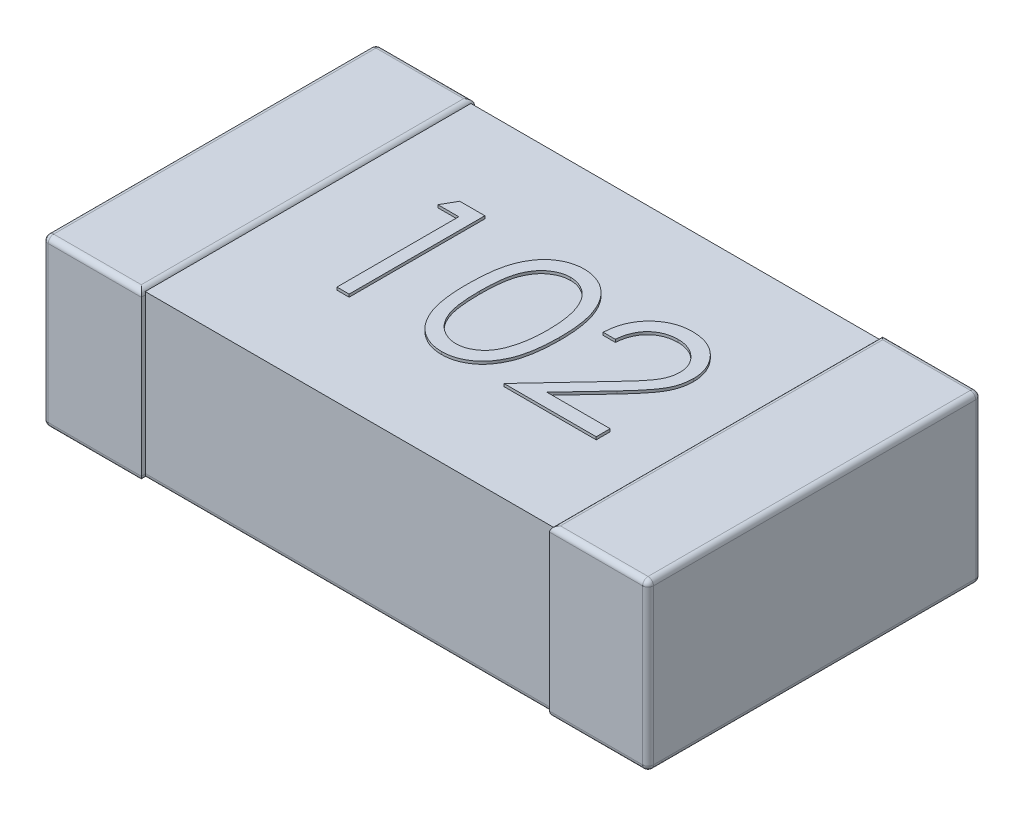
from build123d import *

# Parameters (mm, degrees)
SKETCH1_W           = 2.2
SKETCH1_H           = 1.2
BOSS_EXTRUDE1_DEPTH = 0.6
SKETCH2_W           = 0.362885264
SKETCH2_H           = 1.227310462
BOSS_EXTRUDE2_DEPTH = 0.611
FILLET1_R           = 0.02
WRITING_DEPTH       = 0.01
WRITING_2_DEPTH     = 0.01
WRITING_3_DEPTH     = 0.01


with BuildPart() as part:
    # Sketch1 → Boss-Extrude1 (new body)
    with BuildSketch(Plane(origin=(0, 0, 0), x_dir=(1, 0, 0), z_dir=(0, 1, 0))):
        Rectangle(SKETCH1_W, SKETCH1_H)
    extrude(amount=BOSS_EXTRUDE1_DEPTH)

    # Sketch2 → Boss-Extrude2 (add)
    with BuildSketch(Plane(origin=(0, 0, 0), x_dir=(1, 0, 0), z_dir=(0, 1, 0))):
        with Locations((-0.932127672, -0.002708099)):
            Rectangle(SKETCH2_W, SKETCH2_H)
        with Locations((0.932127672, 0)):
            Rectangle(SKETCH2_W, SKETCH2_H)
    extrude(amount=BOSS_EXTRUDE2_DEPTH)

    # Fillet1
    # the kernel refuses this fillet: 0.02 mm, written as the material it takes off along each edge
    with BuildSketch(Plane(origin=(-1.093570304, 0.02, -0.590947132), x_dir=(0, 0, -1), z_dir=(0, -1, 0))) as fillet1_piece_1_section:
        Polygon((0, 0), (FILLET1_R, 0), (FILLET1_R, -FILLET1_R), (0, -FILLET1_R), align=None)
    fillet1_piece_1 = extrude(amount=FILLET1_R, mode=Mode.PRIVATE)
    fillet1_piece_1 = fillet1_piece_1 - Plane(origin=(-1.093570304, 0.02, -0.590947132), x_dir=(0.7071067811865475, 0, 0.7071067811865475), z_dir=(0, -1, 0)) * Sphere(FILLET1_R, mode=Mode.PRIVATE)
    add(fillet1_piece_1, mode=Mode.SUBTRACT)
    with BuildSketch(Plane(origin=(-1.093570304, 0.02, 0.59636333), x_dir=(0, 0, 1), z_dir=(0, -1, 0))) as fillet1_piece_2_section:
        Polygon((0, 0), (FILLET1_R, 0), (FILLET1_R, FILLET1_R), (0, FILLET1_R), align=None)
    fillet1_piece_2 = extrude(amount=FILLET1_R, mode=Mode.PRIVATE)
    fillet1_piece_2 = fillet1_piece_2 - Plane(origin=(-1.093570304, 0.02, 0.59636333), x_dir=(0.7071067811865474, 0, -0.7071067811865478), z_dir=(0, -1, 0)) * Sphere(FILLET1_R, mode=Mode.PRIVATE)
    add(fillet1_piece_2, mode=Mode.SUBTRACT)
    with BuildSketch(Plane(origin=(1.093570304, 0.02, 0.593655231), x_dir=(1, 0, 0), z_dir=(0, -1, 0))) as fillet1_piece_3_section:
        Polygon((0, 0), (FILLET1_R, 0), (FILLET1_R, FILLET1_R), (0, FILLET1_R), align=None)
    fillet1_piece_3 = extrude(amount=FILLET1_R, mode=Mode.PRIVATE)
    fillet1_piece_3 = fillet1_piece_3 - Plane(origin=(1.093570304, 0.02, 0.593655231), x_dir=(-0.707106781186548, 0, -0.707106781186547), z_dir=(0, -1, 0)) * Sphere(FILLET1_R, mode=Mode.PRIVATE)
    add(fillet1_piece_3, mode=Mode.SUBTRACT)
    with BuildSketch(Plane(origin=(1.093570304, 0.02, -0.593655231), x_dir=(1, 0, 0), z_dir=(0, -1, 0))) as fillet1_piece_4_section:
        Polygon((0, 0), (FILLET1_R, 0), (FILLET1_R, -FILLET1_R), (0, -FILLET1_R), align=None)
    fillet1_piece_4 = extrude(amount=FILLET1_R, mode=Mode.PRIVATE)
    fillet1_piece_4 = fillet1_piece_4 - Plane(origin=(1.093570304, 0.02, -0.593655231), x_dir=(-0.7071067811865474, 0, 0.7071067811865478), z_dir=(0, -1, 0)) * Sphere(FILLET1_R, mode=Mode.PRIVATE)
    add(fillet1_piece_4, mode=Mode.SUBTRACT)
    with BuildSketch(Plane(origin=(-1.093570304, 0.591, -0.590947132), x_dir=(0, 0, -1), z_dir=(0, 1, 0))) as fillet1_piece_5_section:
        Polygon((0, 0), (FILLET1_R, 0), (FILLET1_R, FILLET1_R), (0, FILLET1_R), align=None)
    fillet1_piece_5 = extrude(amount=FILLET1_R, mode=Mode.PRIVATE)
    fillet1_piece_5 = fillet1_piece_5 - Plane(origin=(-1.093570304, 0.591, -0.590947132), x_dir=(0.7071067811865475, 0, 0.7071067811865475), z_dir=(0, 1, 0)) * Sphere(FILLET1_R, mode=Mode.PRIVATE)
    add(fillet1_piece_5, mode=Mode.SUBTRACT)
    with BuildSketch(Plane(origin=(-1.093570304, 0.591, 0.59636333), x_dir=(0, 1, 0), z_dir=(0, 0, 1))) as fillet1_piece_6_section:
        Polygon((0, 0), (FILLET1_R, 0), (FILLET1_R, FILLET1_R), (0, FILLET1_R), align=None)
    fillet1_piece_6 = extrude(amount=FILLET1_R, mode=Mode.PRIVATE)
    fillet1_piece_6 = fillet1_piece_6 - Plane(origin=(-1.093570304, 0.591, 0.59636333), x_dir=(0.7071067811865475, -0.7071067811865475, 0), z_dir=(0, 0, 1)) * Sphere(FILLET1_R, mode=Mode.PRIVATE)
    add(fillet1_piece_6, mode=Mode.SUBTRACT)
    with BuildSketch(Plane(origin=(1.093570304, 0.591, 0.593655231), x_dir=(0, 0, 1), z_dir=(1, 0, 0))) as fillet1_piece_7_section:
        Polygon((0, 0), (FILLET1_R, 0), (FILLET1_R, -FILLET1_R), (0, -FILLET1_R), align=None)
    fillet1_piece_7 = extrude(amount=FILLET1_R, mode=Mode.PRIVATE)
    fillet1_piece_7 = fillet1_piece_7 - Plane(origin=(1.093570304, 0.591, 0.593655231), x_dir=(0, -0.7071067811865475, -0.7071067811865475), z_dir=(1, 0, 0)) * Sphere(FILLET1_R, mode=Mode.PRIVATE)
    add(fillet1_piece_7, mode=Mode.SUBTRACT)
    with BuildSketch(Plane(origin=(1.093570304, 0.591, -0.593655231), x_dir=(0, 0, -1), z_dir=(1, 0, 0))) as fillet1_piece_8_section:
        Polygon((0, 0), (FILLET1_R, 0), (FILLET1_R, FILLET1_R), (0, FILLET1_R), align=None)
    fillet1_piece_8 = extrude(amount=FILLET1_R, mode=Mode.PRIVATE)
    fillet1_piece_8 = fillet1_piece_8 - Plane(origin=(1.093570304, 0.591, -0.593655231), x_dir=(0, -0.7071067811865475, 0.7071067811865475), z_dir=(1, 0, 0)) * Sphere(FILLET1_R, mode=Mode.PRIVATE)
    add(fillet1_piece_8, mode=Mode.SUBTRACT)
    with BuildSketch(Plane(origin=(-0.75068504, 0, -0.660947132), x_dir=(-1, 0, 0), z_dir=(0, 0, 1))) as fillet1_piece_9:
        with BuildLine():
            CenterArc((FILLET1_R, -FILLET1_R), FILLET1_R, 90, 90)
            Line((0, -FILLET1_R), (0, 0))
            Line((0, 0), (FILLET1_R, 0))
        make_face()
    extrude(amount=0.060947132, mode=Mode.SUBTRACT)
    with BuildSketch(Plane(origin=(-1.093570304, 0, -0.610947132), x_dir=(0, 0, 1), z_dir=(1, 0, 0)), Plane(origin=(-0.70068504, 0, 0.61636333), x_dir=(0, 0, -1), z_dir=(-1, 0, 0)), Plane(origin=(-0.70068504, 0.611, 0.61636333), x_dir=(0, -1, 0), z_dir=(-1, 0, 0))) as fillet1_piece_10:
        with BuildLine():
            CenterArc((FILLET1_R, -FILLET1_R), FILLET1_R, 90, 90)
            Line((0, -FILLET1_R), (0, 0))
            Line((0, 0), (FILLET1_R, 0))
        make_face()
    extrude(amount=0.392885264, mode=Mode.SUBTRACT)
    with BuildSketch(Plane(origin=(-0.75068504, 0, 0.6), x_dir=(-1, 0, 0), z_dir=(0, 0, 1))) as fillet1_piece_11:
        with BuildLine():
            CenterArc((FILLET1_R, -FILLET1_R), FILLET1_R, 90, 90)
            Line((0, -FILLET1_R), (0, 0))
            Line((0, 0), (FILLET1_R, 0))
        make_face()
    extrude(amount=0.06636333, mode=Mode.SUBTRACT)
    with BuildSketch(Plane(origin=(-0.75068504, 0, 0.6), x_dir=(0, 0, -1), z_dir=(1, 0, 0)), Plane(origin=(0.75068504, 0, -0.6), x_dir=(0, 0, 1), z_dir=(-1, 0, 0))) as fillet1_piece_12:
        with BuildLine():
            CenterArc((FILLET1_R, FILLET1_R), FILLET1_R, 180, 90)
            Line((0, FILLET1_R), (0, 0))
            Line((0, 0), (FILLET1_R, 0))
        make_face()
    extrude(amount=1.501370079, mode=Mode.SUBTRACT)
    with BuildSketch(Plane(origin=(0.75068504, 0, 0.6), x_dir=(1, 0, 0), z_dir=(0, 0, 1)), Plane(origin=(0.75068504, 0, -0.663655231), x_dir=(1, 0, 0), z_dir=(0, 0, 1))) as fillet1_piece_13:
        with BuildLine():
            CenterArc((FILLET1_R, FILLET1_R), FILLET1_R, 180, 90)
            Line((0, FILLET1_R), (0, 0))
            Line((0, 0), (FILLET1_R, 0))
        make_face()
    extrude(amount=0.063655231, mode=Mode.SUBTRACT)
    with BuildSketch(Plane(origin=(0.70068504, 0, 0.613655231), x_dir=(0, 0, -1), z_dir=(1, 0, 0)), Plane(origin=(1.093570304, 0, -0.613655231), x_dir=(0, 0, 1), z_dir=(-1, 0, 0)), Plane(origin=(-1.093570304, 0.611, -0.610947132), x_dir=(0, 0, 1), z_dir=(1, 0, 0)), Plane(origin=(0.70068504, 0.611, 0.613655231), x_dir=(0, -1, 0), z_dir=(1, 0, 0)), Plane(origin=(1.093570304, 0.611, -0.613655231), x_dir=(0, -1, 0), z_dir=(-1, 0, 0))) as fillet1_piece_14:
        with BuildLine():
            CenterArc((FILLET1_R, FILLET1_R), FILLET1_R, 180, 90)
            Line((0, FILLET1_R), (0, 0))
            Line((0, 0), (FILLET1_R, 0))
        make_face()
    extrude(amount=0.392885264, mode=Mode.SUBTRACT)
    with BuildSketch(Plane(origin=(-1.113570304, 0, 0.59636333), x_dir=(1, 0, 0), z_dir=(0, 0, -1))) as fillet1_piece_15:
        with BuildLine():
            CenterArc((FILLET1_R, -FILLET1_R), FILLET1_R, 90, 90)
            Line((0, -FILLET1_R), (0, 0))
            Line((0, 0), (FILLET1_R, 0))
        make_face()
    extrude(amount=1.187310461, mode=Mode.SUBTRACT)
    with BuildSketch(Plane(origin=(-1.113570304, 0.02, -0.610947132), x_dir=(1, 0, 0), z_dir=(0, 1, 0)), Plane(origin=(1.113570304, 0.02, -0.613655231), x_dir=(0, 0, 1), z_dir=(0, 1, 0))) as fillet1_piece_16:
        with BuildLine():
            CenterArc((FILLET1_R, -FILLET1_R), FILLET1_R, 90, 90)
            Line((0, -FILLET1_R), (0, 0))
            Line((0, 0), (FILLET1_R, 0))
        make_face()
    extrude(amount=0.571, mode=Mode.SUBTRACT)
    with BuildSketch(Plane(origin=(-1.113570304, 0.02, 0.61636333), x_dir=(1, 0, 0), z_dir=(0, 1, 0)), Plane(origin=(1.113570304, 0.02, 0.613655231), x_dir=(0, 0, -1), z_dir=(0, 1, 0))) as fillet1_piece_17:
        with BuildLine():
            CenterArc((FILLET1_R, FILLET1_R), FILLET1_R, 180, 90)
            Line((0, FILLET1_R), (0, 0))
            Line((0, 0), (FILLET1_R, 0))
        make_face()
    extrude(amount=0.571, mode=Mode.SUBTRACT)
    with BuildSketch(Plane(origin=(-1.113570304, 0.611, 0.59636333), x_dir=(1, 0, 0), z_dir=(0, 0, -1)), Plane(origin=(1.113570304, 0, 0.593655231), x_dir=(-1, 0, 0), z_dir=(0, 0, -1)), Plane(origin=(1.113570304, 0.611, 0.593655231), x_dir=(0, -1, 0), z_dir=(0, 0, -1))) as fillet1_piece_18:
        with BuildLine():
            CenterArc((FILLET1_R, FILLET1_R), FILLET1_R, 180, 90)
            Line((0, FILLET1_R), (0, 0))
            Line((0, 0), (FILLET1_R, 0))
        make_face()
    extrude(amount=1.187310461, mode=Mode.SUBTRACT)
    with BuildSketch(Plane(origin=(-0.75068504, 0.611, -0.660947132), x_dir=(0, -1, 0), z_dir=(0, 0, 1))) as fillet1_piece_19_section:
        with BuildLine():
            CenterArc((FILLET1_R, -FILLET1_R), FILLET1_R, 90, 90)
            Line((0, -FILLET1_R), (0, 0))
            Line((0, 0), (FILLET1_R, 0))
        make_face()
    fillet1_piece_19 = extrude(amount=1.327310461, mode=Mode.PRIVATE)
    fillet1_piece_19 = split(fillet1_piece_19, bisect_by=Plane(origin=(-0.751015921, 0.596945436, -0.6), z_dir=(0, 0, -1)), keep=Keep.TOP, mode=Mode.PRIVATE)
    fillet1_piece_19 = split(fillet1_piece_19, bisect_by=Plane(origin=(-0.751015921, 0.6, -0.630473566), z_dir=(0, -1, 0)), keep=Keep.TOP, mode=Mode.PRIVATE)
    add(fillet1_piece_19, mode=Mode.SUBTRACT)
    with BuildSketch(Plane(origin=(-0.75068504, 0.611, -0.660947132), x_dir=(0, -1, 0), z_dir=(0, 0, 1))) as fillet1_piece_20_section:
        with BuildLine():
            CenterArc((FILLET1_R, -FILLET1_R), FILLET1_R, 90, 90)
            Line((0, -FILLET1_R), (0, 0))
            Line((0, 0), (FILLET1_R, 0))
        make_face()
    fillet1_piece_20 = extrude(amount=1.327310461, mode=Mode.PRIVATE)
    fillet1_piece_20 = split(fillet1_piece_20, bisect_by=Plane(origin=(-0.75566279, 0.607493192, -0.6), z_dir=(0, 0, -1)), keep=Keep.TOP, mode=Mode.PRIVATE)
    fillet1_piece_20 = split(fillet1_piece_20, bisect_by=Plane(origin=(-0.75566279, 0.6, -0.630473566), z_dir=(0, 1, 0)), keep=Keep.TOP, mode=Mode.PRIVATE)
    add(fillet1_piece_20, mode=Mode.SUBTRACT)
    with BuildSketch(Plane(origin=(-0.75068504, 0.611, -0.660947132), x_dir=(0, -1, 0), z_dir=(0, 0, 1))) as fillet1_piece_21_section:
        with BuildLine():
            CenterArc((FILLET1_R, -FILLET1_R), FILLET1_R, 90, 90)
            Line((0, -FILLET1_R), (0, 0))
            Line((0, 0), (FILLET1_R, 0))
        make_face()
    fillet1_piece_21 = extrude(amount=1.327310461, mode=Mode.PRIVATE)
    fillet1_piece_21 = split(fillet1_piece_21, bisect_by=Plane(origin=(-0.75566279, 0.607493192, 0.6), z_dir=(0, 0, -1)), keep=Keep.TOP, mode=Mode.PRIVATE)
    fillet1_piece_21 = split(fillet1_piece_21, bisect_by=Plane(origin=(-0.75566279, 0.607493192, -0.6), z_dir=(0, 0, 1)), keep=Keep.TOP, mode=Mode.PRIVATE)
    fillet1_piece_21 = split(fillet1_piece_21, bisect_by=Plane(origin=(-0.75566279, 0.6, 0), z_dir=(0, 1, 0)), keep=Keep.TOP, mode=Mode.PRIVATE)
    add(fillet1_piece_21, mode=Mode.SUBTRACT)
    with BuildSketch(Plane(origin=(-0.75068504, 0.611, -0.660947132), x_dir=(0, -1, 0), z_dir=(0, 0, 1))) as fillet1_piece_22_section:
        with BuildLine():
            CenterArc((FILLET1_R, -FILLET1_R), FILLET1_R, 90, 90)
            Line((0, -FILLET1_R), (0, 0))
            Line((0, 0), (FILLET1_R, 0))
        make_face()
    fillet1_piece_22 = extrude(amount=1.327310461, mode=Mode.PRIVATE)
    fillet1_piece_22 = split(fillet1_piece_22, bisect_by=Plane(origin=(-0.751015921, 0.596945436, 0.6), z_dir=(0, 0, 1)), keep=Keep.TOP, mode=Mode.PRIVATE)
    fillet1_piece_22 = split(fillet1_piece_22, bisect_by=Plane(origin=(-0.751015921, 0.6, 0.633181665), z_dir=(0, -1, 0)), keep=Keep.TOP, mode=Mode.PRIVATE)
    add(fillet1_piece_22, mode=Mode.SUBTRACT)
    with BuildSketch(Plane(origin=(-0.75068504, 0.611, -0.660947132), x_dir=(0, -1, 0), z_dir=(0, 0, 1))) as fillet1_piece_23_section:
        with BuildLine():
            CenterArc((FILLET1_R, -FILLET1_R), FILLET1_R, 90, 90)
            Line((0, -FILLET1_R), (0, 0))
            Line((0, 0), (FILLET1_R, 0))
        make_face()
    fillet1_piece_23 = extrude(amount=1.327310461, mode=Mode.PRIVATE)
    fillet1_piece_23 = split(fillet1_piece_23, bisect_by=Plane(origin=(-0.75566279, 0.607493192, 0.6), z_dir=(0, 0, 1)), keep=Keep.TOP, mode=Mode.PRIVATE)
    fillet1_piece_23 = split(fillet1_piece_23, bisect_by=Plane(origin=(-0.75566279, 0.6, 0.633181665), z_dir=(0, 1, 0)), keep=Keep.TOP, mode=Mode.PRIVATE)
    add(fillet1_piece_23, mode=Mode.SUBTRACT)
    with BuildSketch(Plane(origin=(0.75068504, 0.611, -0.663655231), x_dir=(0, -1, 0), z_dir=(0, 0, 1))) as fillet1_piece_24_section:
        with BuildLine():
            CenterArc((FILLET1_R, FILLET1_R), FILLET1_R, 180, 90)
            Line((0, FILLET1_R), (0, 0))
            Line((0, 0), (FILLET1_R, 0))
        make_face()
    fillet1_piece_24 = extrude(amount=1.327310461, mode=Mode.PRIVATE)
    fillet1_piece_24 = split(fillet1_piece_24, bisect_by=Plane(origin=(0.751015921, 0.596945436, -0.6), z_dir=(0, 0, -1)), keep=Keep.TOP, mode=Mode.PRIVATE)
    fillet1_piece_24 = split(fillet1_piece_24, bisect_by=Plane(origin=(0.751015921, 0.6, -0.631827615), z_dir=(0, -1, 0)), keep=Keep.TOP, mode=Mode.PRIVATE)
    add(fillet1_piece_24, mode=Mode.SUBTRACT)
    with BuildSketch(Plane(origin=(0.75068504, 0.611, -0.663655231), x_dir=(0, -1, 0), z_dir=(0, 0, 1))) as fillet1_piece_25_section:
        with BuildLine():
            CenterArc((FILLET1_R, FILLET1_R), FILLET1_R, 180, 90)
            Line((0, FILLET1_R), (0, 0))
            Line((0, 0), (FILLET1_R, 0))
        make_face()
    fillet1_piece_25 = extrude(amount=1.327310461, mode=Mode.PRIVATE)
    fillet1_piece_25 = split(fillet1_piece_25, bisect_by=Plane(origin=(0.75566279, 0.607493192, -0.6), z_dir=(0, 0, -1)), keep=Keep.TOP, mode=Mode.PRIVATE)
    fillet1_piece_25 = split(fillet1_piece_25, bisect_by=Plane(origin=(0.75566279, 0.6, -0.631827615), z_dir=(0, 1, 0)), keep=Keep.TOP, mode=Mode.PRIVATE)
    add(fillet1_piece_25, mode=Mode.SUBTRACT)
    with BuildSketch(Plane(origin=(0.75068504, 0.611, -0.663655231), x_dir=(0, -1, 0), z_dir=(0, 0, 1))) as fillet1_piece_26_section:
        with BuildLine():
            CenterArc((FILLET1_R, FILLET1_R), FILLET1_R, 180, 90)
            Line((0, FILLET1_R), (0, 0))
            Line((0, 0), (FILLET1_R, 0))
        make_face()
    fillet1_piece_26 = extrude(amount=1.327310461, mode=Mode.PRIVATE)
    fillet1_piece_26 = split(fillet1_piece_26, bisect_by=Plane(origin=(0.75566279, 0.607493192, -0.6), z_dir=(0, 0, 1)), keep=Keep.TOP, mode=Mode.PRIVATE)
    fillet1_piece_26 = split(fillet1_piece_26, bisect_by=Plane(origin=(0.75566279, 0.6, 0), z_dir=(0, 1, 0)), keep=Keep.TOP, mode=Mode.PRIVATE)
    fillet1_piece_26 = split(fillet1_piece_26, bisect_by=Plane(origin=(0.75566279, 0.607493192, 0.6), z_dir=(0, 0, -1)), keep=Keep.TOP, mode=Mode.PRIVATE)
    add(fillet1_piece_26, mode=Mode.SUBTRACT)
    with BuildSketch(Plane(origin=(0.75068504, 0.611, -0.663655231), x_dir=(0, -1, 0), z_dir=(0, 0, 1))) as fillet1_piece_27_section:
        with BuildLine():
            CenterArc((FILLET1_R, FILLET1_R), FILLET1_R, 180, 90)
            Line((0, FILLET1_R), (0, 0))
            Line((0, 0), (FILLET1_R, 0))
        make_face()
    fillet1_piece_27 = extrude(amount=1.327310461, mode=Mode.PRIVATE)
    fillet1_piece_27 = split(fillet1_piece_27, bisect_by=Plane(origin=(0.751015921, 0.6, 0.631827615), z_dir=(0, -1, 0)), keep=Keep.TOP, mode=Mode.PRIVATE)
    fillet1_piece_27 = split(fillet1_piece_27, bisect_by=Plane(origin=(0.751015921, 0.596945436, 0.6), z_dir=(0, 0, 1)), keep=Keep.TOP, mode=Mode.PRIVATE)
    add(fillet1_piece_27, mode=Mode.SUBTRACT)
    with BuildSketch(Plane(origin=(0.75068504, 0.611, -0.663655231), x_dir=(0, -1, 0), z_dir=(0, 0, 1))) as fillet1_piece_28_section:
        with BuildLine():
            CenterArc((FILLET1_R, FILLET1_R), FILLET1_R, 180, 90)
            Line((0, FILLET1_R), (0, 0))
            Line((0, 0), (FILLET1_R, 0))
        make_face()
    fillet1_piece_28 = extrude(amount=1.327310461, mode=Mode.PRIVATE)
    fillet1_piece_28 = split(fillet1_piece_28, bisect_by=Plane(origin=(0.75566279, 0.6, 0.631827615), z_dir=(0, 1, 0)), keep=Keep.TOP, mode=Mode.PRIVATE)
    fillet1_piece_28 = split(fillet1_piece_28, bisect_by=Plane(origin=(0.75566279, 0.607493192, 0.6), z_dir=(0, 0, 1)), keep=Keep.TOP, mode=Mode.PRIVATE)
    add(fillet1_piece_28, mode=Mode.SUBTRACT)
    with BuildSketch(Plane(origin=(0.75068504, 0, -0.6), x_dir=(0, 0, 1), z_dir=(-1, 0, 0))) as fillet1_piece_29a_section:
        with BuildLine():
            CenterArc((FILLET1_R, FILLET1_R), FILLET1_R, 180, 90)
            Line((0, FILLET1_R), (0, 0))
            Line((0, 0), (FILLET1_R, 0))
        make_face()
    fillet1_piece_29a = extrude(amount=1.551370079, mode=Mode.PRIVATE)
    fillet1_piece_29a = split(fillet1_piece_29a, bisect_by=Plane(origin=(-0.75068504, 0.004527902, -0.595472098), z_dir=(-1, 0, 0)), keep=Keep.TOP, mode=Mode.PRIVATE)
    with BuildSketch(Plane(origin=(-0.75068504, 0, -0.660947132), x_dir=(-1, 0, 0), z_dir=(0, 0, 1))) as fillet1_piece_29b_section:
        with BuildLine():
            CenterArc((FILLET1_R, -FILLET1_R), FILLET1_R, 90, 90)
            Line((0, -FILLET1_R), (0, 0))
            Line((0, 0), (FILLET1_R, 0))
        make_face()
    fillet1_piece_29b = extrude(amount=0.110947132, mode=Mode.PRIVATE)
    fillet1_piece_29b = split(fillet1_piece_29b, bisect_by=Plane(origin=(-0.755212942, 0.004527902, -0.6), z_dir=(0, 0, 1)), keep=Keep.TOP, mode=Mode.PRIVATE)
    fillet1_piece_29 = fillet1_piece_29a & fillet1_piece_29b
    add(fillet1_piece_29, mode=Mode.SUBTRACT)
    with BuildSketch(Plane(origin=(-0.75068504, 0, 0.55), x_dir=(-1, 0, 0), z_dir=(0, 0, 1))) as fillet1_piece_30a_section:
        with BuildLine():
            CenterArc((FILLET1_R, -FILLET1_R), FILLET1_R, 90, 90)
            Line((0, -FILLET1_R), (0, 0))
            Line((0, 0), (FILLET1_R, 0))
        make_face()
    fillet1_piece_30a = extrude(amount=0.11636333, mode=Mode.PRIVATE)
    fillet1_piece_30a = split(fillet1_piece_30a, bisect_by=Plane(origin=(-0.755212942, 0.004527902, 0.6), z_dir=(0, 0, -1)), keep=Keep.TOP, mode=Mode.PRIVATE)
    with BuildSketch(Plane(origin=(-0.80068504, 0, 0.6), x_dir=(0, 0, -1), z_dir=(1, 0, 0))) as fillet1_piece_30b_section:
        with BuildLine():
            CenterArc((FILLET1_R, FILLET1_R), FILLET1_R, 180, 90)
            Line((0, FILLET1_R), (0, 0))
            Line((0, 0), (FILLET1_R, 0))
        make_face()
    fillet1_piece_30b = extrude(amount=1.551370079, mode=Mode.PRIVATE)
    fillet1_piece_30b = split(fillet1_piece_30b, bisect_by=Plane(origin=(-0.75068504, 0.004527902, 0.595472098), z_dir=(-1, 0, 0)), keep=Keep.TOP, mode=Mode.PRIVATE)
    fillet1_piece_30 = fillet1_piece_30a & fillet1_piece_30b
    add(fillet1_piece_30, mode=Mode.SUBTRACT)
    with BuildSketch(Plane(origin=(-0.75068504, 0, 0.6), x_dir=(0, 0, -1), z_dir=(1, 0, 0))) as fillet1_piece_31a_section:
        with BuildLine():
            CenterArc((FILLET1_R, FILLET1_R), FILLET1_R, 180, 90)
            Line((0, FILLET1_R), (0, 0))
            Line((0, 0), (FILLET1_R, 0))
        make_face()
    fillet1_piece_31a = extrude(amount=1.551370079, mode=Mode.PRIVATE)
    fillet1_piece_31a = split(fillet1_piece_31a, bisect_by=Plane(origin=(0.75068504, 0.004527902, 0.595472098), z_dir=(1, 0, 0)), keep=Keep.TOP, mode=Mode.PRIVATE)
    with BuildSketch(Plane(origin=(0.75068504, 0, 0.55), x_dir=(1, 0, 0), z_dir=(0, 0, 1))) as fillet1_piece_31b_section:
        with BuildLine():
            CenterArc((FILLET1_R, FILLET1_R), FILLET1_R, 180, 90)
            Line((0, FILLET1_R), (0, 0))
            Line((0, 0), (FILLET1_R, 0))
        make_face()
    fillet1_piece_31b = extrude(amount=0.113655231, mode=Mode.PRIVATE)
    fillet1_piece_31b = split(fillet1_piece_31b, bisect_by=Plane(origin=(0.755212942, 0.004527902, 0.6), z_dir=(0, 0, -1)), keep=Keep.TOP, mode=Mode.PRIVATE)
    fillet1_piece_31 = fillet1_piece_31a & fillet1_piece_31b
    add(fillet1_piece_31, mode=Mode.SUBTRACT)
    with BuildSketch(Plane(origin=(0.75068504, 0, -0.663655231), x_dir=(1, 0, 0), z_dir=(0, 0, 1))) as fillet1_piece_32a_section:
        with BuildLine():
            CenterArc((FILLET1_R, FILLET1_R), FILLET1_R, 180, 90)
            Line((0, FILLET1_R), (0, 0))
            Line((0, 0), (FILLET1_R, 0))
        make_face()
    fillet1_piece_32a = extrude(amount=0.113655231, mode=Mode.PRIVATE)
    fillet1_piece_32a = split(fillet1_piece_32a, bisect_by=Plane(origin=(0.755212942, 0.004527902, -0.6), z_dir=(0, 0, 1)), keep=Keep.TOP, mode=Mode.PRIVATE)
    with BuildSketch(Plane(origin=(0.80068504, 0, -0.6), x_dir=(0, 0, 1), z_dir=(-1, 0, 0))) as fillet1_piece_32b_section:
        with BuildLine():
            CenterArc((FILLET1_R, FILLET1_R), FILLET1_R, 180, 90)
            Line((0, FILLET1_R), (0, 0))
            Line((0, 0), (FILLET1_R, 0))
        make_face()
    fillet1_piece_32b = extrude(amount=1.551370079, mode=Mode.PRIVATE)
    fillet1_piece_32b = split(fillet1_piece_32b, bisect_by=Plane(origin=(0.75068504, 0.004527902, -0.595472098), z_dir=(1, 0, 0)), keep=Keep.TOP, mode=Mode.PRIVATE)
    fillet1_piece_32 = fillet1_piece_32a & fillet1_piece_32b
    add(fillet1_piece_32, mode=Mode.SUBTRACT)


with BuildPart() as body_2:
    # Sketch3 → Writing (new body)
    with BuildSketch(Plane(origin=(0, 0.6, 0), x_dir=(1, 0, 0), z_dir=(0, 1, 0))):
        Polygon((-0.451422276, 0.257601552), (-0.358974359, 0.257601552), (-0.358974359, -0.242398448), (-0.403846154, -0.242398448), (-0.403846154, 0.206319501), (-0.480769231, 0.206319501), align=None)
    extrude(amount=WRITING_DEPTH)


with BuildPart() as body_3:
    # Sketch3 → Writing 2 (new body)
    with BuildSketch(Plane(origin=(0, 0.6, 0), x_dir=(1, 0, 0), z_dir=(0, 1, 0))):
        with BuildLine():
            add(Edge.make_bspline(
                [(-0.173076923, 0.007401232), (-0.173030063, 0.015415144), (-0.172939038, 0.030982285), (-0.171926406, 0.053665805), (-0.170244214, 0.074945847), (-0.167938875, 0.094823427), (-0.16513345, 0.11330368), (-0.16138838, 0.130337216), (-0.157129408, 0.146002874), (-0.152193345, 0.160351738), (-0.14662366, 0.173577125), (-0.140561623, 0.185923582), (-0.133766653, 0.197372429), (-0.126627094, 0.208106399), (-0.11885394, 0.217949784), (-0.110668399, 0.227041593), (-0.101750988, 0.235171701), (-0.092404844, 0.242578315), (-0.082545349, 0.249071097), (-0.07245354, 0.25479006), (-0.062059953, 0.259675755), (-0.051336213, 0.263517246), (-0.040378704, 0.266690224), (-0.029149123, 0.268860073), (-0.017628929, 0.270225346), (-0.009853009, 0.27035587), (-0.005909455, 0.270422065)],
                knots=[0, 0, 0, 0, 1.646270934, 3.197905019, 4.663502075, 6.030701355, 7.308322542, 8.50163776, 9.611534131, 10.641858119, 11.616356847, 12.558055219, 13.465016945, 14.349605745, 15.204443733, 16.039544428, 16.859896111, 17.680448484, 18.487036065, 19.28249412, 20.06191084, 20.843045899, 21.620316918, 22.403196591, 23.190181807, 24, 24, 24, 24], degree=3))
            add(Edge.make_bspline(
                [(-0.005909455, 0.270422065), (-0.001932958, 0.270352377), (0.005975043, 0.27021379), (0.017666525, 0.268881798), (0.029087908, 0.266671638), (0.0401905, 0.26354007), (0.051065498, 0.259654973), (0.061627842, 0.254785385), (0.071943139, 0.249116976), (0.081847466, 0.242456422), (0.091449554, 0.235030382), (0.100513548, 0.226635715), (0.109040275, 0.217357184), (0.117136747, 0.207294061), (0.124573261, 0.196253334), (0.13165518, 0.184427033), (0.137994042, 0.171608338), (0.144098996, 0.158011128), (0.149368565, 0.143259177), (0.154120886, 0.12743564), (0.157960739, 0.110353613), (0.161159206, 0.092102721), (0.163637048, 0.072615937), (0.165441712, 0.051935035), (0.16639501, 0.030046408), (0.166574538, 0.015081001), (0.166666667, 0.007401232)],
                knots=[0, 0, 0, 0, 0.810914788, 1.612654377, 2.396697861, 3.181598691, 3.963628158, 4.749916497, 5.551656086, 6.361998678, 7.18212741, 8.025565596, 8.878627764, 9.750805457, 10.657531673, 11.591944965, 12.560506719, 13.57287815, 14.630710178, 15.753379473, 16.941251878, 18.199788006, 19.531962791, 20.947069417, 22.433333509, 24, 24, 24, 24], degree=3))
            add(Edge.make_bspline(
                [(0.166666667, 0.007401232), (0.166573583, -0.000245041), (0.166392214, -0.015143491), (0.165452398, -0.03693363), (0.163601165, -0.057504779), (0.161285453, -0.076906274), (0.158078172, -0.095057362), (0.154134577, -0.112020855), (0.14975596, -0.127870008), (0.144350989, -0.142474981), (0.138435173, -0.156039513), (0.131998717, -0.168706248), (0.125103027, -0.180587147), (0.117590349, -0.191587111), (0.109582719, -0.201784062), (0.100908749, -0.210998008), (0.091812951, -0.219450962), (0.082182606, -0.226972623), (0.072123813, -0.233556166), (0.061843945, -0.239443859), (0.051160605, -0.244191387), (0.040315897, -0.248267821), (0.029154702, -0.251382172), (0.017690932, -0.25353558), (0.005982898, -0.255045844), (-0.001931611, -0.255161055), (-0.005909455, -0.25521896)],
                knots=[0, 0, 0, 0, 1.561518951, 3.042555995, 4.452378317, 5.7783523, 7.031515105, 8.214008947, 9.334062868, 10.386615937, 11.391082383, 12.354592575, 13.286541444, 14.194233754, 15.072674879, 15.931287219, 16.775624067, 17.606195743, 18.42308326, 19.229000347, 20.022332153, 20.807536673, 21.593273796, 22.3848459, 23.188221202, 24, 24, 24, 24], degree=3))
            add(Edge.make_bspline(
                [(-0.005909455, -0.25521896), (-0.0098529, -0.255152338), (-0.017628604, -0.255020972), (-0.029150379, -0.253661868), (-0.040333585, -0.251476796), (-0.051233407, -0.248417281), (-0.061905766, -0.244672304), (-0.072205236, -0.239793207), (-0.082246333, -0.234174054), (-0.09200227, -0.227774708), (-0.101289721, -0.220443039), (-0.110160951, -0.212333855), (-0.118393096, -0.203244796), (-0.12605511, -0.193319379), (-0.133337123, -0.182648915), (-0.140035605, -0.171087719), (-0.146231441, -0.158681632), (-0.151894797, -0.145350502), (-0.156916034, -0.130899798), (-0.161351421, -0.115164201), (-0.164853444, -0.098004824), (-0.167851009, -0.079559486), (-0.170268778, -0.059748925), (-0.171919396, -0.038562385), (-0.172939583, -0.01601307), (-0.173030308, -0.000545959), (-0.173076923, 0.007401232)],
                knots=[0, 0, 0, 0, 0.810891512, 1.598919785, 2.382837074, 3.152667961, 3.926044502, 4.706494248, 5.493654104, 6.291793342, 7.103789334, 7.925228297, 8.761435821, 9.622817696, 10.50288917, 11.416980706, 12.369136599, 13.353924996, 14.394355917, 15.514179734, 16.714354668, 17.994756427, 19.357759367, 20.818452758, 22.365282078, 24, 24, 24, 24], degree=3))
        make_face()
        with BuildLine():
            add(Edge.make_bspline(
                [(-0.128205128, 0.007601552), (-0.128188064, 0.000923167), (-0.128154947, -0.012038268), (-0.127289775, -0.03087302), (-0.126111171, -0.04844021), (-0.124590985, -0.064762143), (-0.122333421, -0.079783574), (-0.11980388, -0.093607814), (-0.116725582, -0.106161705), (-0.113083436, -0.117531392), (-0.108934994, -0.127909831), (-0.104405585, -0.137567147), (-0.099539767, -0.146617424), (-0.094094174, -0.154979368), (-0.088163451, -0.162680248), (-0.081881557, -0.169856367), (-0.075014045, -0.176255936), (-0.06551351, -0.183931201), (-0.052971157, -0.191862506), (-0.037168234, -0.19876909), (-0.020929884, -0.203109441), (-0.009908277, -0.203661406), (-0.004407051, -0.203936909)],
                knots=[0, 0, 0, 0, 1.459021318, 2.831673884, 4.118529203, 5.306027144, 6.411944654, 7.436330062, 8.375795394, 9.233974572, 10.042671642, 10.816086306, 11.563610507, 12.285937304, 12.993564865, 13.685989202, 14.367179055, 15.041617293, 16.353048772, 17.594441528, 18.799311195, 20, 20, 20, 20], degree=3))
            add(Edge.make_bspline(
                [(-0.004407051, -0.203936909), (0.001129759, -0.203708655), (0.012191948, -0.203252617), (0.028353919, -0.198852798), (0.044043957, -0.192214292), (0.056339949, -0.184364648), (0.065694598, -0.176889173), (0.072397025, -0.170515651), (0.078548746, -0.163379099), (0.084383328, -0.1556792), (0.089734625, -0.147268845), (0.094600787, -0.138188477), (0.099041266, -0.12841288), (0.101571129, -0.121588632), (0.102864583, -0.118099569)],
                knots=[0, 0, 0, 0, 1.353760809, 2.704726607, 4.075137775, 5.516104923, 6.260822281, 7.007110065, 7.778089737, 8.566572457, 9.372053459, 10.217411131, 11.088608312, 12, 12, 12, 12], degree=3))
            add(Edge.make_bspline(
                [(0.102864583, -0.118099569), (0.104371979, -0.113638178), (0.107432638, -0.10457964), (0.111377177, -0.09052769), (0.114483663, -0.075784438), (0.117278429, -0.060437993), (0.119186009, -0.044375178), (0.12072141, -0.027645695), (0.121625794, -0.010236929), (0.121737902, 0.001590927), (0.121794872, 0.007601552)],
                knots=[0, 0, 0, 0, 0.884706709, 1.796334032, 2.740027952, 3.714592787, 4.726048262, 5.777819803, 6.87074269, 8, 8, 8, 8], degree=3))
            add(Edge.make_bspline(
                [(0.121794872, 0.007601552), (0.121716273, 0.013611206), (0.121562518, 0.025367372), (0.120974805, 0.042584255), (0.119457152, 0.058936792), (0.117771564, 0.074495431), (0.115286246, 0.089174046), (0.11260656, 0.103095518), (0.109006386, 0.116087379), (0.105160704, 0.128353033), (0.100759219, 0.139753127), (0.095914114, 0.150340811), (0.090739577, 0.1601672), (0.085119257, 0.169205334), (0.079119874, 0.177495698), (0.072583081, 0.184872068), (0.065768171, 0.191563064), (0.056222858, 0.199200574), (0.043726531, 0.206987959), (0.028177153, 0.214154496), (0.011995633, 0.218269966), (0.001056568, 0.218850207), (-0.004407051, 0.219140014)],
                knots=[0, 0, 0, 0, 1.31362396, 2.569729283, 3.763502607, 4.902122613, 5.988968491, 7.01645872, 7.998833611, 8.933434873, 9.825090667, 10.667526885, 11.477055099, 12.250526234, 12.991942729, 13.710640831, 14.402115721, 15.076753259, 16.378508321, 17.609869233, 18.806226677, 20, 20, 20, 20], degree=3))
            add(Edge.make_bspline(
                [(-0.004407051, 0.219140014), (-0.009937136, 0.218849807), (-0.02100738, 0.218268865), (-0.037357087, 0.214169829), (-0.053029138, 0.20702512), (-0.06549242, 0.199174781), (-0.075044389, 0.191697879), (-0.081770488, 0.1852141), (-0.088077084, 0.178121778), (-0.093886756, 0.170350076), (-0.099328082, 0.16199788), (-0.104325369, 0.152999485), (-0.108827845, 0.143309291), (-0.112982779, 0.132935514), (-0.116636034, 0.121566808), (-0.119649458, 0.10902838), (-0.122433322, 0.09524811), (-0.124404075, 0.080145323), (-0.12615604, 0.063819301), (-0.127281947, 0.046208256), (-0.128157841, 0.027341916), (-0.12818905, 0.014313464), (-0.128205128, 0.007601552)],
                knots=[0, 0, 0, 0, 1.207732386, 2.417664972, 3.655092373, 4.956220595, 5.625982001, 6.301752483, 6.994047911, 7.697131622, 8.419323945, 9.170223765, 9.943494443, 10.752040957, 11.610060368, 12.549350801, 13.567764191, 14.679664412, 15.874934091, 17.154273443, 18.533957287, 20, 20, 20, 20], degree=3))
        make_face(mode=Mode.SUBTRACT)
    extrude(amount=WRITING_2_DEPTH)


with BuildPart() as body_4:
    # Sketch3 → Writing 3 (new body)
    with BuildSketch(Plane(origin=(0, 0.6, 0), x_dir=(1, 0, 0), z_dir=(0, 1, 0))):
        with BuildLine():
            Line((0.275641026, 0.103755399), (0.230769231, 0.103755399))
            add(Edge.make_bspline(
                [(0.230769231, 0.103755399), (0.231061681, 0.109708383), (0.231636046, 0.121399885), (0.234325802, 0.138446157), (0.238174498, 0.1547397), (0.243616135, 0.170149687), (0.250374174, 0.184812374), (0.258478464, 0.198669519), (0.268077586, 0.21166826), (0.278964262, 0.223688095), (0.290788353, 0.234714891), (0.303546344, 0.244237069), (0.316952777, 0.25228245), (0.330966977, 0.259008342), (0.345747057, 0.264056891), (0.361158894, 0.26780284), (0.377270199, 0.270056603), (0.388247345, 0.270298859), (0.393830128, 0.270422065)],
                knots=[0, 0, 0, 0, 1.10065271, 2.161652631, 3.183658789, 4.190468796, 5.17591951, 6.163126047, 7.15150782, 8.156236427, 9.156009102, 10.134482811, 11.092018607, 12.041330605, 13.001268258, 13.972401359, 14.968799086, 16, 16, 16, 16], degree=3))
            add(Edge.make_bspline(
                [(0.393830128, 0.270422065), (0.39931271, 0.270293714), (0.410085788, 0.270041509), (0.425808933, 0.267875648), (0.440777118, 0.264483421), (0.454961085, 0.259724075), (0.468247665, 0.2533263), (0.480736672, 0.245640937), (0.492576787, 0.23675239), (0.503234899, 0.22628756), (0.513021768, 0.21511579), (0.521464947, 0.203188947), (0.528695399, 0.190870478), (0.53472221, 0.178066449), (0.539158802, 0.164656302), (0.542527117, 0.150835273), (0.544431033, 0.1364603), (0.544723237, 0.126730792), (0.544871795, 0.121784245)],
                knots=[0, 0, 0, 0, 1.111607364, 2.184268762, 3.212621178, 4.221274766, 5.211760367, 6.196651075, 7.1921475, 8.207485113, 9.220403448, 10.201281604, 11.166441695, 12.114753415, 13.065576456, 14.026450734, 14.996634279, 16, 16, 16, 16], degree=3))
            add(Edge.make_bspline(
                [(0.544871795, 0.121784245), (0.5446299, 0.114820268), (0.544150356, 0.101014524), (0.540048302, 0.080726686), (0.533641657, 0.061070483), (0.525927749, 0.045250869), (0.518145972, 0.032503227), (0.511133471, 0.022007697), (0.502924212, 0.010706916), (0.493398712, -0.001361275), (0.482754016, -0.014291404), (0.470893707, -0.028075661), (0.45773321, -0.042571628), (0.448496281, -0.052472428), (0.443709936, -0.057602775)],
                knots=[0, 0, 0, 0, 1.184426356, 2.348067706, 3.509069118, 4.696110526, 5.333549288, 6.050745305, 6.844228056, 7.710549037, 8.667450064, 9.695053472, 10.805634456, 12, 12, 12, 12], degree=3))
            Line((0.443709936, -0.057602775), (0.318609776, -0.191116396))
            Line((0.318609776, -0.191116396), (0.551282051, -0.191116396))
            Line((0.551282051, -0.191116396), (0.551282051, -0.242398448))
            Line((0.551282051, -0.242398448), (0.211538462, -0.242398448))
            Line((0.211538462, -0.242398448), (0.405448718, -0.035467358))
            add(Edge.make_bspline(
                [(0.405448718, -0.035467358), (0.410169845, -0.030539028), (0.419238163, -0.021072716), (0.432064245, -0.007252293), (0.443584101, 0.00556907), (0.4538723, 0.017367148), (0.462705658, 0.028314515), (0.470544548, 0.038056616), (0.476825347, 0.047021537), (0.483641832, 0.057413053), (0.490243829, 0.070100527), (0.495917023, 0.08560534), (0.499376287, 0.101566376), (0.499791263, 0.112352381), (0.5, 0.117777834)],
                knots=[0, 0, 0, 0, 1.329631726, 2.553950428, 3.673215718, 4.687767853, 5.603093632, 6.413772471, 7.123043292, 7.734684054, 8.834405432, 9.900288307, 10.943827018, 12, 12, 12, 12], degree=3))
            add(Edge.make_bspline(
                [(0.5, 0.117777834), (0.49990918, 0.121189463), (0.49973019, 0.127913127), (0.498150519, 0.137771093), (0.495763304, 0.147280352), (0.492342553, 0.156470155), (0.487827304, 0.165248105), (0.482331107, 0.173624888), (0.47598967, 0.181723311), (0.468653774, 0.18931664), (0.460594985, 0.196271098), (0.452081521, 0.202431681), (0.443074363, 0.207580126), (0.433611489, 0.211800625), (0.423719279, 0.215111394), (0.413378601, 0.217405477), (0.402618027, 0.218845832), (0.395270385, 0.219040713), (0.391526442, 0.219140014)],
                knots=[0, 0, 0, 0, 0.991446411, 1.95395049, 2.89581595, 3.838931463, 4.798493298, 5.75982156, 6.748411868, 7.785213223, 8.824556874, 9.840280684, 10.836137867, 11.835679398, 12.848801643, 13.863922112, 14.911575587, 16, 16, 16, 16], degree=3))
            add(Edge.make_bspline(
                [(0.391526442, 0.219140014), (0.387616323, 0.219037866), (0.379937495, 0.218837266), (0.368663348, 0.217434028), (0.357908237, 0.215013194), (0.347645108, 0.21170224), (0.337856595, 0.207493876), (0.328590303, 0.202252198), (0.319867034, 0.195997414), (0.311670387, 0.188905905), (0.30411839, 0.181010534), (0.297483122, 0.172209111), (0.291685406, 0.162662337), (0.286626944, 0.152395973), (0.282518988, 0.141316861), (0.279379967, 0.129464332), (0.276896132, 0.116889849), (0.276066343, 0.108206265), (0.275641026, 0.103755399)],
                knots=[0, 0, 0, 0, 1.031018746, 2.02475058, 2.990194455, 3.934040569, 4.864654155, 5.795059489, 6.735614925, 7.690564532, 8.649604399, 9.611025574, 10.590972636, 11.591080095, 12.624614302, 13.701020113, 14.821632451, 16, 16, 16, 16], degree=3))
        make_face()
    extrude(amount=WRITING_3_DEPTH)


solid = Compound([part.part, body_2.part, body_3.part, body_4.part])
